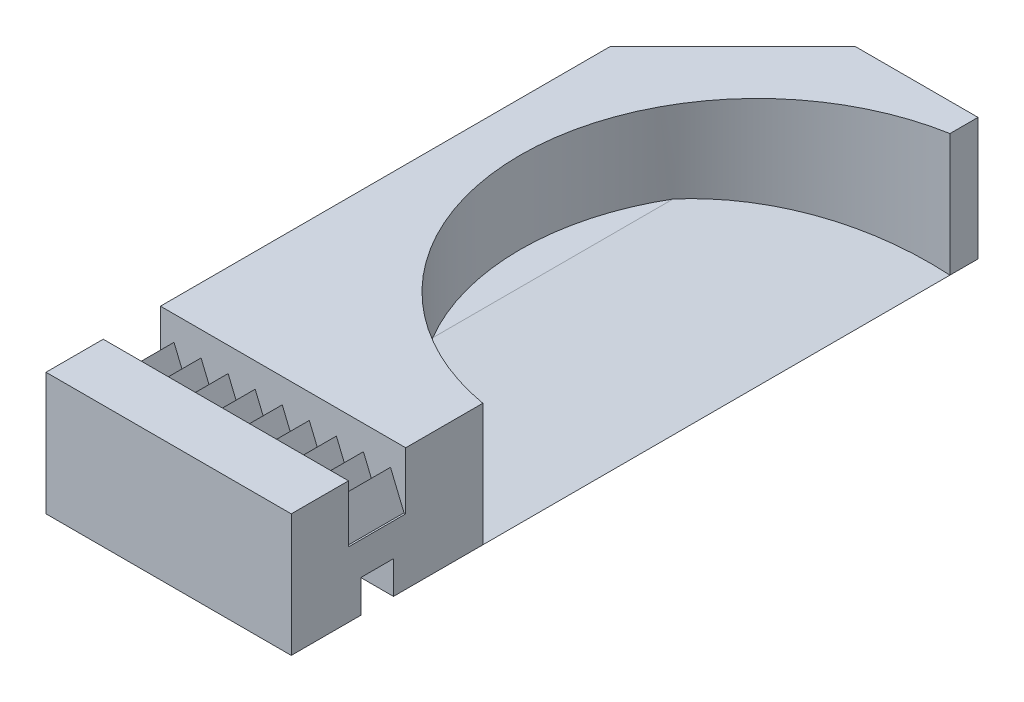
from build123d import *

# Parameters (mm, degrees)
ESQUISSE2_W                = 30
ESQUISSE2_H                = 84
BOSS_EXTRU_1_DEPTH         = 15
ESQUISSE3_R                = 29
ENL_V_MAT_EXTRU_1_DEPTH    = 10
CHANFREIN1_SIZE            = 5
CHANFREIN1_SIZE_2          = 20
CHANFREIN2_SIZE            = 15
ESQUISSE7_W                = 30
ESQUISSE7_H                = 7
ENL_V_MAT_EXTRU_2_DEPTH    = 7
BOSS_EXTRU_2_DEPTH         = 7
R_P_TITION_LIN_AIRE1_COUNT = 9
R_P_TITION_LIN_AIRE1_PITCH = 3.31
ENL_V_MAT_EXTRU_3_REACH    = 56.708
ESQUISSE9_W                = 4
ESQUISSE9_H                = 4


with BuildPart() as part:
    # Esquisse2 → Boss.-Extru.1 (new body)
    with BuildSketch(Plane(origin=(0, 0, 0), x_dir=(1, 0, 0), z_dir=(0, 1, 0))):
        with Locations((-17.412854797, -1.219560319)):
            Rectangle(ESQUISSE2_W, ESQUISSE2_H)
    extrude(amount=BOSS_EXTRU_1_DEPTH)

    # Esquisse3 → Enlèv. mat.-Extru.1 (cut)
    with BuildSketch(Plane(origin=(0, 15, 0), x_dir=(1, 0, 0), z_dir=(0, 1, 0))):
        with Locations((2.587145203, 8.780439681)):
            Circle(ESQUISSE3_R)
    extrude(amount=-ENL_V_MAT_EXTRU_1_DEPTH, mode=Mode.SUBTRACT)

    # Chanfrein1
    # the kernel refuses this chamfer: 20, 5 mm, written as the material it takes off along each edge
    with BuildSketch(Plane(origin=(-2.412854797, 5, -89.288703391), x_dir=(0.14778356633657125, -0.9890197255468893, 0), z_dir=(0, 0, 1))) as chanfrein1_piece_1_section:
        Polygon((CHANFREIN1_SIZE * 0.989019725547, -CHANFREIN1_SIZE * 0.147783566337), (-CHANFREIN1_SIZE_2 * 0.147783566337, -CHANFREIN1_SIZE_2 * 0.989019725547), (0, 0), align=None)
    chanfrein1_piece_1 = extrude(amount=161.016527419, mode=Mode.PRIVATE)
    chanfrein1_piece_1 = chanfrein1_piece_1 & Plane(origin=(2.587145203, 3.276810051, -8.780439681), x_dir=(1, 0, 0), z_dir=(0, 1, 0)) * Cylinder(29, 402, mode=Mode.PRIVATE)
    add(chanfrein1_piece_1, mode=Mode.SUBTRACT)

    # Chanfrein2
    chanfrein2_edges = [part.edges().sort_by_distance(p)[0] for p in [
        (-32.412854797, 7.5, -40.780439681),
    ]]
    chamfer(chanfrein2_edges, length=CHANFREIN2_SIZE)

    # Esquisse7 → Enlèv. mat.-Extru.2 (cut)
    with BuildSketch(Plane(origin=(0, 15, 0), x_dir=(1, 0, 0), z_dir=(0, 1, 0))):
        with Locations((-17.412854797, -32.719560319)):
            Rectangle(ESQUISSE7_W, ESQUISSE7_H)
    extrude(amount=-ENL_V_MAT_EXTRU_2_DEPTH, mode=Mode.SUBTRACT)

    # Esquisse8 → Boss.-Extru.2 (add)
    with BuildSketch(Plane.XY.offset(29.219560319)):
        Polygon((-32.412854797, 8), (-29.099146298, 8), (-30.756000548, 12), align=None)
    boss_extru_2 = extrude(amount=BOSS_EXTRU_2_DEPTH)

    # Répétition linéaire1: Boss.-Extru.2 ×9
    with Locations(*[(i * R_P_TITION_LIN_AIRE1_PITCH, 0, 0) for i in range(1, R_P_TITION_LIN_AIRE1_COUNT)]):
        add(boss_extru_2)

    # Esquisse9 → Enlèv. mat.-Extru.3 (cut, up to next)
    with BuildSketch(Plane(origin=(-2.412854797, 0, 0), x_dir=(0, 0, -1), z_dir=(1, 0, 0)), mode=Mode.PRIVATE) as enl_v_mat_extru_3_sk1:
        with Locations((-32.719560319, 2)):
            Rectangle(ESQUISSE9_W, ESQUISSE9_H)
    enl_v_mat_extru_3_tool1 = extrude(enl_v_mat_extru_3_sk1.sketch, amount=-ENL_V_MAT_EXTRU_3_REACH, mode=Mode.PRIVATE) & part.part
    add(enl_v_mat_extru_3_tool1.solids().sort_by_distance((-2.412855, 2, 32.71956))[0], mode=Mode.SUBTRACT)


solid = part.part
